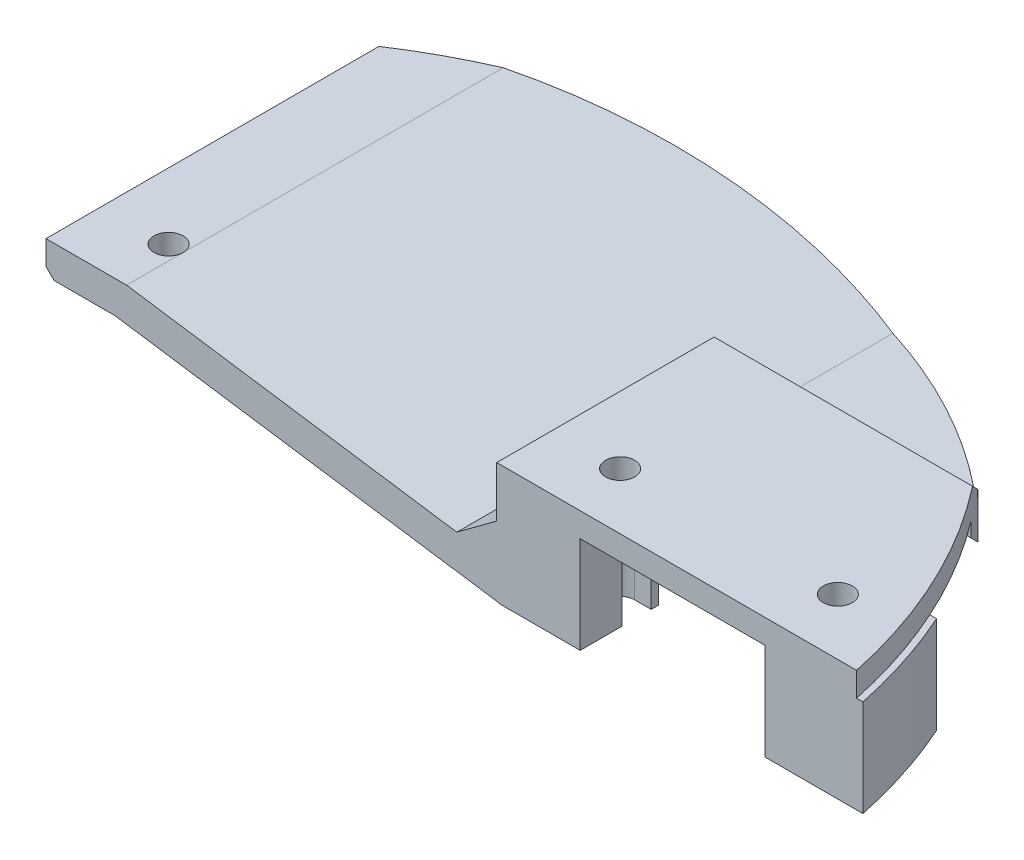
from build123d import *

# Parameters (mm, degrees)
SKETCH1_W            = 10
SKETCH1_H            = 10
BOSS_EXTRUDE1_DEPTH  = 4
CHAMFER1_SIZE        = 1
BOSS_EXTRUDE2_DEPTH  = 16
BOSS_EXTRUDE3_DEPTH  = 10
BOSS_EXTRUDE4_DEPTH  = 13
CHAMFER2_SIZE        = 10.3
BOSS_EXTRUDE5_DEPTH  = 30
CUT_EXTRUDE2_REACH   = 128.642
CUT_EXTRUDE1_START   = -15
CUT_EXTRUDE1_DEPTH   = 15
M3_CLEARANCE_HOLE1_D = 3.6
SKETCH11_W           = 1.8
SKETCH11_H           = 7.9
CHAMFER3_SIZE        = 5
CHAMFER3_SIZE2       = 4.40344093
BOSS_EXTRUDE6_DEPTH  = 12


# Read off the part's stored shape, not the designer's step: Cut-Extrude1
with BuildPart() as part:
    # Sketch1 → Boss-Extrude1 (new body)
    with BuildSketch(Plane(origin=(0, 0, 0), x_dir=(1, 0, 0), z_dir=(0, 1, 0))):
        with Locations((-5, 5)):
            Rectangle(SKETCH1_W, SKETCH1_H)
    extrude(amount=BOSS_EXTRUDE1_DEPTH)

    # Chamfer1
    chamfer1_edges = [part.edges().sort_by_distance(p)[0] for p in [
        (-10, 0, -5),
    ]]
    chamfer(chamfer1_edges, length=CHAMFER1_SIZE)

    # Sketch2 → Boss-Extrude2 (add)
    with BuildSketch(Plane(origin=(0, 0, -10), x_dir=(-1, 0, 0), z_dir=(0, 0, -1))):
        Polygon((10, 4), (0, 4), (-45.9, -2.784614526), (-45.9, 7.9), (-95.9, 7.9), (-95.9, 4.9), (-49.9, 4.9), (-49.9, -7.1), (-46.192330133, -7.1), (-46.146212438, -7.037883956), (1.467233005, 0), (9, 0), (10, 1), align=None)
    extrude(amount=BOSS_EXTRUDE2_DEPTH)

    # Sketch2<4> → Boss-Extrude3 (add)
    with BuildSketch(Plane(origin=(0, 0, -10), x_dir=(-1, 0, 0), z_dir=(0, 0, -1))):
        Polygon((1.467233005, 0), (0, 0), (0, 4), (-45.9, -2.784614526), (-45.9, 7.9), (-95.9, 7.9), (-95.9, 4.9), (-49.9, 4.9), (-49.9, -7.1), (-46.192330133, -7.1), (-46.146212438, -7.037883956), align=None)
    extrude(amount=-BOSS_EXTRUDE3_DEPTH)

    # Sketch3 → Boss-Extrude4 (add)
    with BuildSketch(Plane(origin=(0, 0, -26), x_dir=(-1, 0, 0), z_dir=(0, 0, -1))):
        Polygon((-95.9, 4.9), (-95.9, -7.1), (-49.9, -7.1), (-46.192330133, -7.1), (-46.146212438, -7.037883956), (1.467233005, 0), (9, 0), (10, 1), (10, 4), (0, 4), (-45.9, -2.784614526), (-45.9, 7.9), (-95.9, 7.9), align=None)
    extrude(amount=BOSS_EXTRUDE4_DEPTH)

    # Chamfer2
    chamfer2_edges = [part.edges().sort_by_distance(p)[0] for p in [
        (72.9, -7.1, -26),
    ]]
    chamfer(chamfer2_edges, length=CHAMFER2_SIZE)

    # Sketch4 → Boss-Extrude5 (add)
    with BuildSketch(Plane(origin=(0, 0, -39), x_dir=(-1, 0, 0), z_dir=(0, 0, -1))):
        Polygon((-95.9, 7.9), (-95.9, -7.1), (-46.192330133, -7.1), (-46.146212438, -7.037883956), (1.467233005, 0), (9, 0), (10, 1), (10, 4), (0, 4), (-45.9, -2.784614526), (-45.9, 7.9), align=None)
    extrude(amount=BOSS_EXTRUDE5_DEPTH)

    # Sketch15 → Cut-Extrude2 (cut, up to next)
    with BuildSketch(Plane(origin=(95.9, 0, 0), x_dir=(0, 0, -1), z_dir=(1, 0, 0)), mode=Mode.PRIVATE) as cut_extrude2_sk1:
        Polygon((69, -2.784614526), (37.641468776, -2.784614526), (26.956854249, 7.9), (69, 7.9), align=None)
    cut_extrude2_tool1 = extrude(cut_extrude2_sk1.sketch, amount=-CUT_EXTRUDE2_REACH, mode=Mode.PRIVATE) & part.part
    add(cut_extrude2_tool1.solids().sort_by_distance((95.9, 2.816908, -50.519973))[0], mode=Mode.SUBTRACT)

    # Cut-Extrude1 outline → Cut-Extrude1 (cut)
    with BuildSketch(Plane(origin=(0, 7.9, 0), x_dir=(1, 0, 0), z_dir=(0, 1, 0)).offset(CUT_EXTRUDE1_START)):
        with BuildLine():
            Line((90.528084846, 0), (95.9, 0))
            Line((95.9, 0), (95.9, 69))
            Line((95.9, 69), (-10, 69))
            Line((-10, 69), (-10, 41.287361933))
            ThreePointArc((-10, 41.287361933), (51.179168383, 47.220256879), (90.528084846, 0))
        make_face()
    extrude(amount=CUT_EXTRUDE1_DEPTH, mode=Mode.SUBTRACT)

    # M3 Clearance Hole1 (through all)
    with Locations(Plane(origin=(0, 4.9, 0), x_dir=(-1, 0, 0), z_dir=(0, -1, 0))):
        with Locations((-81.2, 7), (-54.2, 7)):
            Hole(M3_CLEARANCE_HOLE1_D / 2)

    # Sketch11 → M3 Clearance Hole2 (revolve, cut)
    with BuildSketch(Plane(origin=(-1.8, 0, -7), x_dir=(0, 0, -1), z_dir=(1, 0, 0))):
        with Locations((0.9, 3.95)):
            Rectangle(SKETCH11_W, SKETCH11_H)
    revolve(axis=Axis((-1.8, -6.35, -7), (0, 1, 0)), mode=Mode.SUBTRACT)

    # Chamfer3
    chamfer3_edges = [part.edges().sort_by_distance(p)[0] for p in [
        (45.9, -2.784614526, -18.820734388),
    ]]
    chamfer3_side = [part.faces().sort_by_distance(p)[0] for p in [
        (23.128110629, 0.581365679, -25.371340031),
    ]]
    chamfer(chamfer3_edges, length=CHAMFER3_SIZE, length2=CHAMFER3_SIZE2, reference=chamfer3_side[0])

    # Sketch12 → Cut-Revolve1 (revolve, cut)
    with BuildSketch(Plane.XY.offset(-25)):
        Polygon((0, -0.5), (22, -0.5), (92, -7.331568331), (90.828874, -19.331568331), (0, -10.467230343), align=None)
    revolve(axis=Axis((90.828874, -19.331568331, -25), (-0.9952714730097288, 0.09713235821828223, 0)), mode=Mode.SUBTRACT)

    # Sketch14 → Boss-Extrude6 (add)
    with BuildSketch(Plane.XZ.offset(-4.9)):
        with BuildLine():
            Line((49.9, 0), (49.9, -13.5))
            Line((49.9, -13.5), (56.25, -13.5))
            Line((56.25, -13.5), (56.25, -12.5))
            Line((56.25, -12.5), (51.45, -12.5))
            Line((51.45, -12.5), (51.45, -9.7))
            Line((51.45, -9.7), (56.25, -9.7))
            Line((56.25, -9.7), (56.25, -8.8))
            Line((56.25, -8.8), (54.2, -8.8))
            ThreePointArc((54.2, -8.8), (52.4, -7), (54.2, -5.2))
            Line((54.2, -5.2), (56.25, -5.2))
            Line((56.25, -5.2), (56.25, 0))
            Line((56.25, 0), (49.9, 0))
        make_face()
        with BuildLine():
            Line((79.15, -13.5), (86.943744534, -13.5))
            ThreePointArc((86.943744534, -13.5), (89.487636648, -6.866742476), (91.309542311, 0))
            Line((91.309542311, 0), (79.15, 0))
            Line((79.15, 0), (79.15, -5.2))
            Line((79.15, -5.2), (81.2, -5.2))
            ThreePointArc((81.2, -5.2), (83, -7), (81.2, -8.8))
            Line((81.2, -8.8), (79.15, -8.8))
            Line((79.15, -8.8), (79.15, -9.7))
            Line((79.15, -9.7), (83.95, -9.7))
            Line((83.95, -9.7), (83.95, -12.5))
            Line((83.95, -12.5), (79.15, -12.5))
            Line((79.15, -12.5), (79.15, -13.5))
        make_face()
    extrude(amount=BOSS_EXTRUDE6_DEPTH)


solid = part.part
